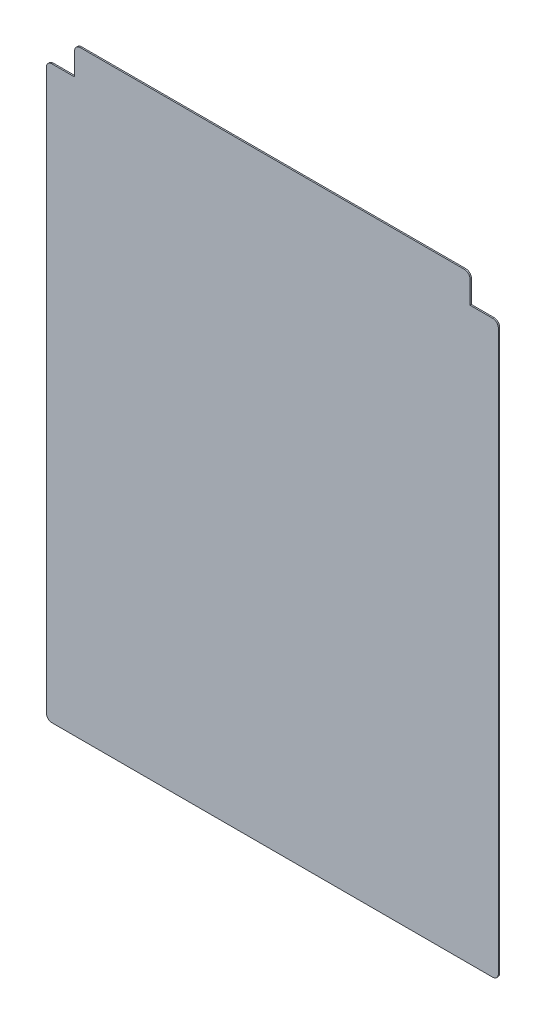
from build123d import *

# Parameters (mm, degrees)
TABAN_FLAN_1_DEPTH = 1.2
K_ELERI_START      = -1.2
K_ELERI_K_R1_DEPTH = 1.2


# Read off the part's stored shape, not the designer's step: Köşeleri kır1
# Sheet-metal steps are written as plain solids
with BuildPart() as part:
    # Çizim1 → Taban-Flanş1 (new body)
    with BuildSketch(Plane.XY):
        Polygon((-200, 0), (200, 0), (200, 505), (175, 505), (175, 530), (-175, 530), (-175, 505), (-200, 505), align=None)
    extrude(amount=-TABAN_FLAN_1_DEPTH)

    # Köşeleri kır1 outline → Köşeleri kır1 (cut)
    with BuildSketch(Plane.XY.offset(K_ELERI_START)):
        with BuildLine():
            ThreePointArc((200, 5), (198.535533906, 1.464466094), (195, 0))
            Line((195, 0), (200, 0))
            Line((200, 0), (200, 5))
        make_face()
        with BuildLine():
            Line((-200, 0), (-195, 0))
            ThreePointArc((-195, 0), (-198.535533906, 1.464466094), (-200, 5))
            Line((-200, 5), (-200, 0))
        make_face()
        with BuildLine():
            ThreePointArc((195, 505), (198.535533906, 503.535533906), (200, 500))
            Line((200, 500), (200, 505))
            Line((200, 505), (195, 505))
        make_face()
        with BuildLine():
            Line((-200, 505), (-200, 500))
            ThreePointArc((-200, 500), (-198.535533906, 503.535533906), (-195, 505))
            Line((-195, 505), (-200, 505))
        make_face()
        with BuildLine():
            ThreePointArc((170, 530), (173.535533906, 528.535533906), (175, 525))
            Line((175, 525), (175, 530))
            Line((175, 530), (170, 530))
        make_face()
        with BuildLine():
            Line((-175, 530), (-175, 525))
            ThreePointArc((-175, 525), (-173.535533906, 528.535533906), (-170, 530))
            Line((-170, 530), (-175, 530))
        make_face()
    extrude(amount=K_ELERI_K_R1_DEPTH, mode=Mode.SUBTRACT)


solid = part.part
